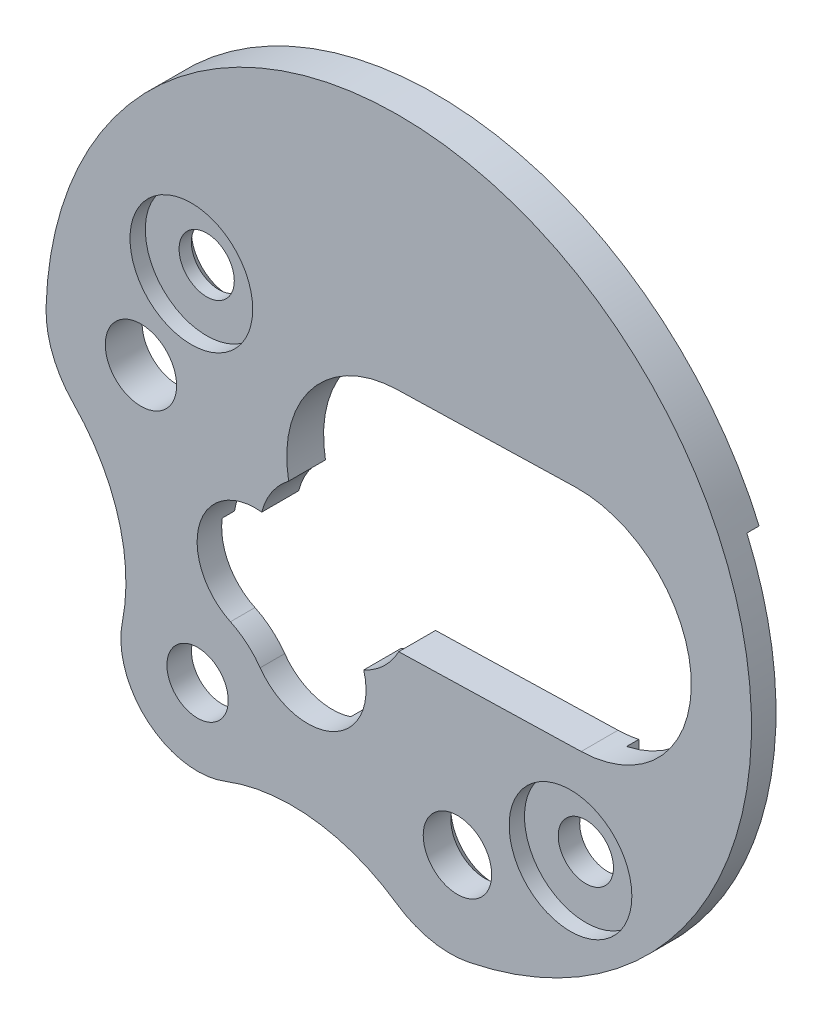
from build123d import *
from OCP.BRepAlgoAPI import BRepAlgoAPI_Cut
from OCP.TopTools import TopTools_ListOfShape

# Parameters (mm, degrees)
BOSS_EXTRUDE1_DEPTH = 0.6
CUT_EXTRUDE1_DEPTH  = 0.2
SKETCH3_R           = 5.02
CUT_EXTRUDE2_DEPTH  = 0.2
HOLE1_D             = 1.162628638
HOLE2_D             = 1.115918006
HOLE3_D             = 1
HOLE3_DEPTH         = 0.6001
HOLE4_D             = 0.9
HOLE4_CBORE_D       = 2
HOLE4_CBORE_DEPTH   = 0.25
CHAMFER1_SIZE       = 0.15
FILLET1_R           = 1.55


with BuildPart() as part:
    # Sketch1 → Boss-Extrude1 (new body)
    with BuildSketch(Plane(origin=(0, 0, 0), x_dir=(-1, 0, 0), z_dir=(0, 0, -1))):
        with BuildLine():
            ThreePointArc((-10.73984142, -9.642233438), (-9.237924029, -8.831220946), (-7.536736276, -8.970710503))
            ThreePointArc((-7.536736276, -8.970710503), (-6.280146099, -8.76234417), (-5.858651118, -7.560355242))
            ThreePointArc((-5.858651118, -7.560355242), (-5.703315536, -5.860541144), (-4.645947853, -4.520589395))
            ThreePointArc((-4.645947853, -4.520589395), (-14.062387044, 0.497211479), (-10.73984142, -9.642233438))
        make_face()
        with BuildLine():
            Line((-10.362858107, -5.727073657), (-13.337303888, -5.648813517))
            ThreePointArc((-13.337303888, -5.648813517), (-15.131326546, -3.757835425), (-13.240348455, -1.963812767))
            Line((-13.240348455, -1.963812767), (-10.332680536, -2.040315926))
            ThreePointArc((-10.332680536, -2.040315926), (-8.949116824, -2.722465033), (-8.568642053, -4.217394763))
            ThreePointArc((-8.568642053, -4.217394763), (-8.294480547, -4.508437442), (-8.130929885, -4.873295708))
            ThreePointArc((-8.130929885, -4.873295708), (-7.112967422, -5.558507477), (-7.619937202, -6.675979798))
            ThreePointArc((-7.619937202, -6.675979798), (-7.888624675, -6.848520839), (-8.104829371, -7.083507857))
            ThreePointArc((-8.104829371, -7.083507857), (-9.292871814, -7.39061288), (-9.792686542, -6.269923994))
            ThreePointArc((-9.792686542, -6.269923994), (-10.123466132, -6.046492366), (-10.362858107, -5.727073657))
        make_face(mode=Mode.SUBTRACT)
    extrude(amount=-BOSS_EXTRUDE1_DEPTH)


with BuildPart() as cut_extrude1_tool:
    # Sketch2 → Cut-Extrude1 (new body)
    with BuildSketch(Plane(origin=(0, 0, 0), x_dir=(-1, 0, 0), z_dir=(0, 0, -1))):
        with BuildLine():
            Line((-9.182196127, -7.435630798), (-9.505531001, -7.707379249))
            ThreePointArc((-9.505531001, -7.707379249), (-10.019572014, -8.382539981), (-10.195186161, -9.212744683))
            ThreePointArc((-10.195186161, -9.212744683), (-8.894364476, -8.779749468), (-7.536736276, -8.97071434))
            ThreePointArc((-7.536736276, -8.97071434), (-6.280146099, -8.762348007), (-5.858651118, -7.560359079))
            ThreePointArc((-5.858651118, -7.560359079), (-5.86528742, -6.418236665), (-5.444571647, -5.356405283))
            ThreePointArc((-5.444571647, -5.356405283), (-6.302543189, -5.330829684), (-7.087113788, -5.678993801))
            ThreePointArc((-7.087113788, -5.678993801), (-7.189102384, -6.265354701), (-7.619937202, -6.675966608))
            ThreePointArc((-7.619937202, -6.675966608), (-7.888634149, -6.84851254), (-8.104845502, -7.083507857))
            ThreePointArc((-8.104845502, -7.083507857), (-8.585255131, -7.43783823), (-9.182196127, -7.435630798))
        make_face()
    extrude(amount=-CUT_EXTRUDE1_DEPTH)


with BuildPart() as part_1:
    add(part.part)

    # Cut-Extrude1: cut by cut_extrude1_tool, with a tolerance
    cut_extrude1_stock = TopTools_ListOfShape()
    cut_extrude1_stock.Append(part_1.part.wrapped)
    cut_extrude1_tools = TopTools_ListOfShape()
    cut_extrude1_tools.Append(cut_extrude1_tool.part.wrapped)
    cut_extrude1_cut = BRepAlgoAPI_Cut()
    cut_extrude1_cut.SetArguments(cut_extrude1_stock)
    cut_extrude1_cut.SetTools(cut_extrude1_tools)
    cut_extrude1_cut.SetFuzzyValue(0.00001)
    cut_extrude1_cut.Build()
    add(Compound.cast(cut_extrude1_cut.Shape()).solids(), mode=Mode.REPLACE)

    # Sketch3 → Cut-Extrude2 (cut)
    with BuildSketch(Plane(origin=(0, 0, 0), x_dir=(-1, 0, 0), z_dir=(0, 0, -1))):
        with Locations((-18.696793444, -5.59532139)):
            Circle(SKETCH3_R)
    extrude(amount=-CUT_EXTRUDE2_DEPTH, mode=Mode.SUBTRACT)

    # Sketch4 → Cut-Revolve1 (revolve, cut)
    with BuildSketch(Plane(origin=(0, -2.083255033, 0), x_dir=(1, 0, 0), z_dir=(0, 1, 0))):
        Polygon((7.58298739, 0), (6.98298739, 0), (6.98298739, -0.6), (7.98298739, -0.6), (7.98298739, -0.35), (7.43298739, -0.35), (7.43298739, -0.15), align=None)
    revolve(axis=Axis((6.98298739, -2.083255033, 0), (0, 0, 1)), mode=Mode.SUBTRACT)

    # Hole1 (through all)
    with Locations(Plane.XY.offset(0.6)):
        with Locations((6.16136425, -3.782231089)):
            Hole(HOLE1_D / 2)

    # Hole2 (through all)
    with Locations(Plane(origin=(0, 0, 0), x_dir=(-1, 0, 0), z_dir=(0, 0, -1))):
        with Locations((-11.320076522, -8.117897225)):
            Hole(HOLE2_D / 2)

    # Hole3
    with Locations(Plane.XY.offset(0.6)):
        with Locations((7.08439152, -7.80542761)):
            Hole(HOLE3_D / 2, depth=HOLE3_DEPTH)

    # Hole4 (through all)
    with Locations(Plane.XY.offset(0.6)):
        with Locations((13.162833859, -7.277138633)):
            CounterBoreHole(HOLE4_D / 2, HOLE4_CBORE_D / 2, HOLE4_CBORE_DEPTH)

    # Chamfer1
    chamfer1_edges = [part_1.edges().sort_by_distance(p)[0] for p in [
        (10.762117519, -8.117897225, 0),
    ]]
    chamfer(chamfer1_edges, length=CHAMFER1_SIZE)

    # Fillet1
    fillet1_edges = [part_1.edges().sort_by_distance(p)[0] for p in [
        (4.645947853, -4.520589395, 0.3),
        (10.73984142, -9.642233438, 0.3),
    ]]
    fillet(fillet1_edges, radius=FILLET1_R)


solid = part_1.part
